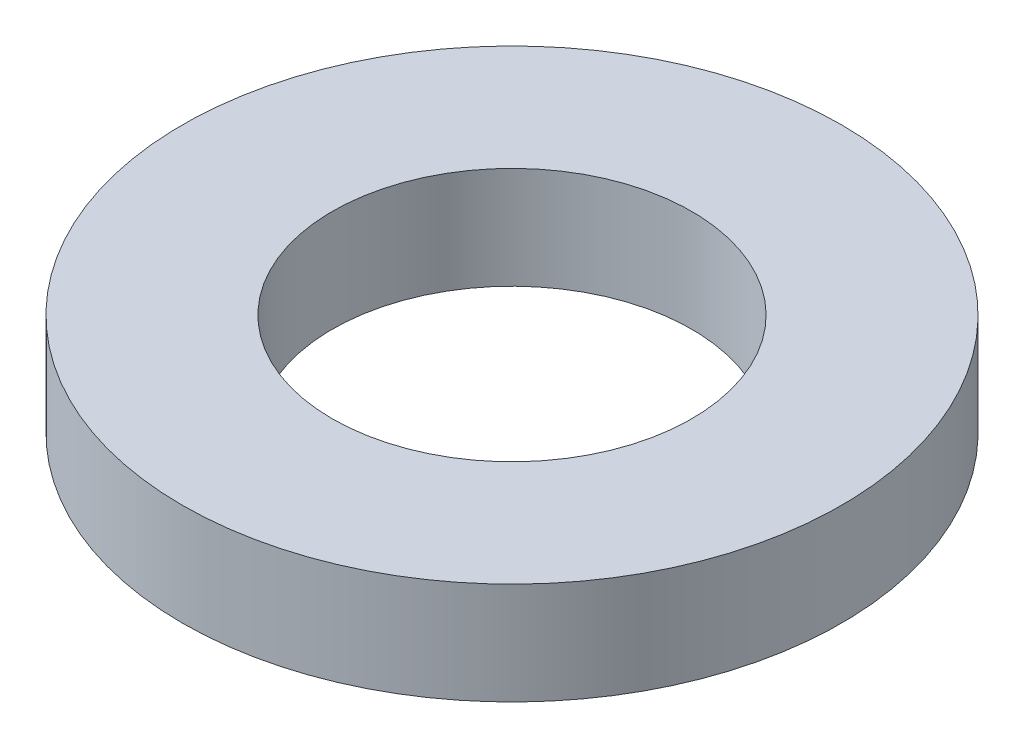
from build123d import *

# Parameters (mm, degrees)
SKETCH1_R           = 11.6459
SKETCH1_R_2         = 6.35
BOSS_EXTRUDE1_DEPTH = 1.8034


with BuildPart() as part:
    # Sketch1 → Boss-Extrude1 (new, symmetric)
    with BuildSketch(Plane(origin=(0, 0, 0), x_dir=(1, 0, 0), z_dir=(0, 1, 0))):
        Circle(SKETCH1_R)
        Circle(SKETCH1_R_2, mode=Mode.SUBTRACT)
    extrude(amount=BOSS_EXTRUDE1_DEPTH, both=True)


solid = part.part
